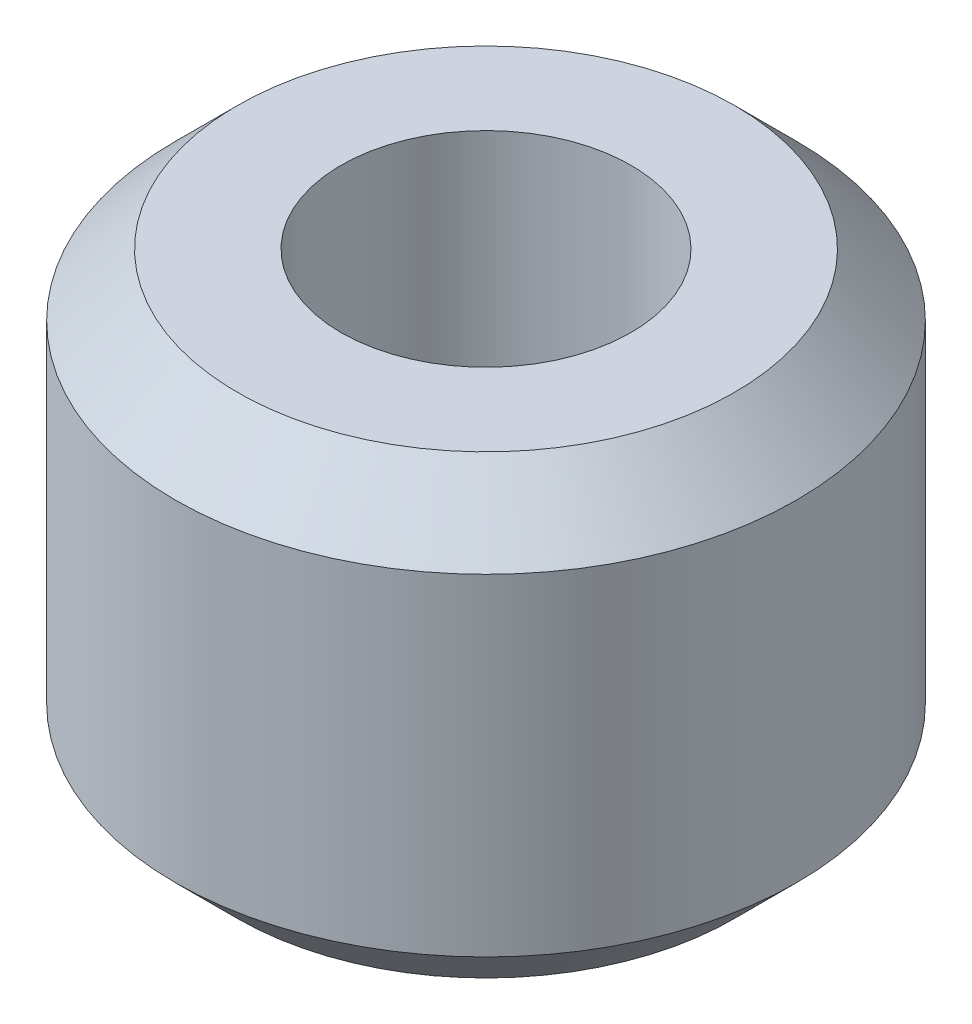
from build123d import *

# Parameters (mm, degrees)
SKETCH1_R           = 7.5
SKETCH1_R_2         = 3.5
BOSS_EXTRUDE1_DEPTH = 11
CHAMFER1_SIZE       = 1
CHAMFER2_SIZE       = 1.5


with BuildPart() as part:
    # Sketch1 → Boss-Extrude1 (new body)
    with BuildSketch(Plane(origin=(0, 0, 0), x_dir=(1, 0, 0), z_dir=(0, 1, 0))):
        with Locations(Location((0, 0, 0), (0, 0, 270))):
            Circle(SKETCH1_R)
        with Locations(Location((0, 0, 0), (0, 0, 270))):
            Circle(SKETCH1_R_2, mode=Mode.SUBTRACT)
    extrude(amount=BOSS_EXTRUDE1_DEPTH)

    # Chamfer1
    chamfer1_edges = [part.edges().sort_by_distance(p)[0] for p in [
        (0, 0, -3.5),
    ]]
    chamfer(chamfer1_edges, length=CHAMFER1_SIZE)

    # Chamfer2
    chamfer2_edges = [part.edges().sort_by_distance(p)[0] for p in [
        (0, 0, -7.5),
        (0, 11, -7.5),
    ]]
    chamfer(chamfer2_edges, length=CHAMFER2_SIZE)


solid = part.part
